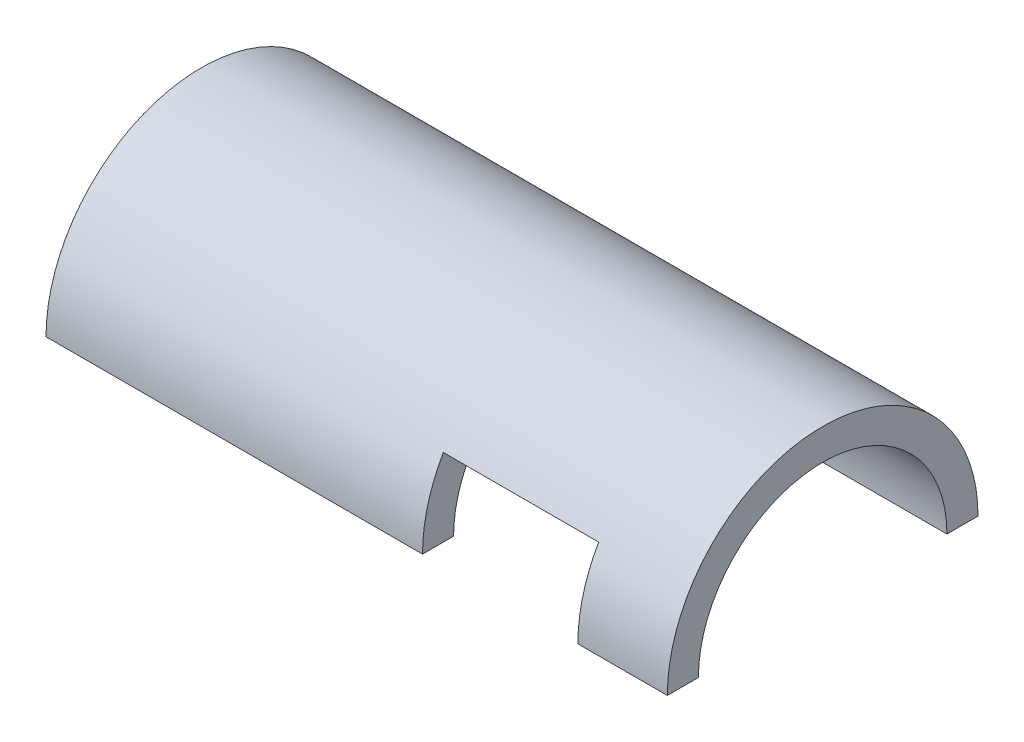
from build123d import *

# Parameters (mm, degrees)
BOSS_EXTRUDE1_DEPTH = 127
SKETCH2_W           = 31.75
SKETCH2_H           = 15.875
CUT_EXTRUDE1_DEPTH  = 127


with BuildPart() as part:
    # Sketch1 → Boss-Extrude1 (new body)
    with BuildSketch(Plane(origin=(0, 0, 0), x_dir=(0, 0, -1), z_dir=(1, 0, 0))):
        with BuildLine():
            Line((-31.75, 0), (-25.4, 0))
            ThreePointArc((-25.4, 0), (0, 25.4), (25.4, 0))
            Line((25.4, 0), (31.75, 0))
            ThreePointArc((31.75, 0), (0, 31.75), (-31.75, 0))
        make_face()
    extrude(amount=-BOSS_EXTRUDE1_DEPTH)

    # Sketch2 → Cut-Extrude1 (cut)
    with BuildSketch(Plane.XY):
        with Locations((-34.163, 7.9375)):
            Rectangle(SKETCH2_W, SKETCH2_H)
    extrude(amount=CUT_EXTRUDE1_DEPTH, mode=Mode.SUBTRACT)


solid = part.part
